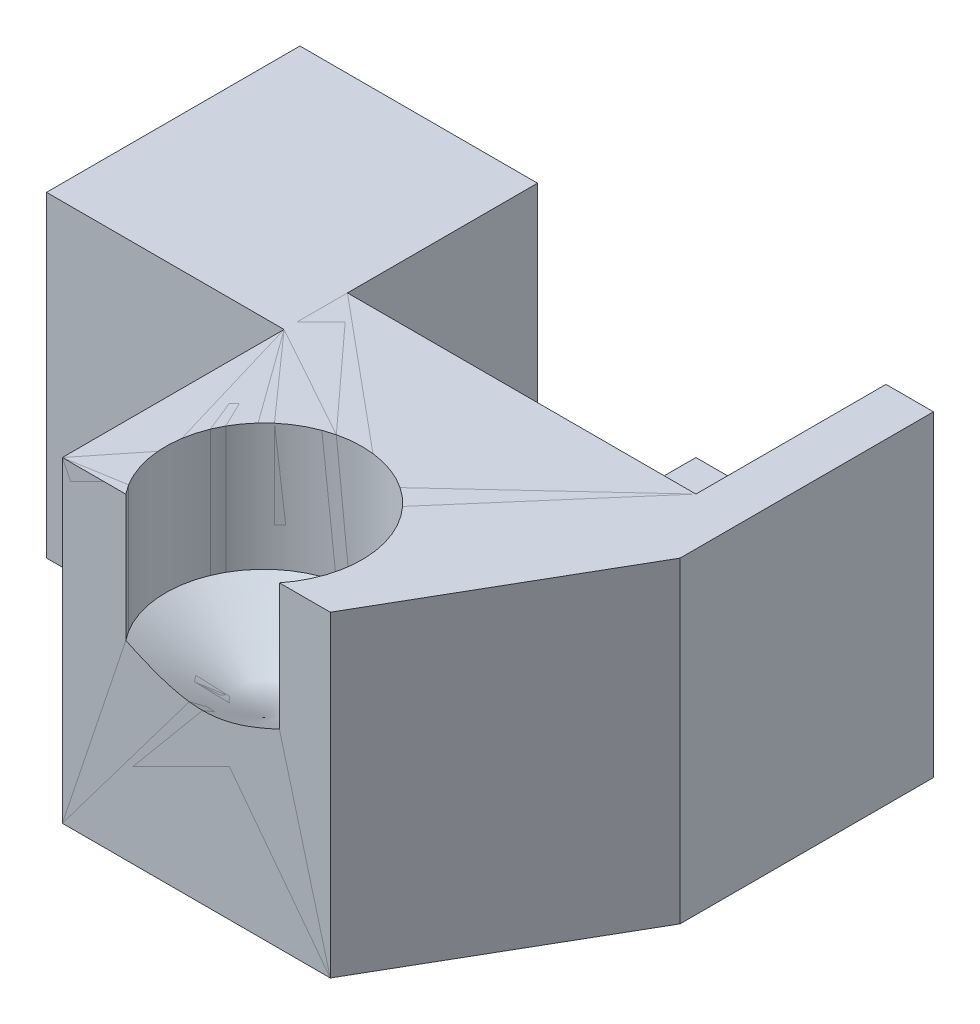
from build123d import *

# Parameters (mm, degrees)
BOSS_EXTRUDE1_DEPTH              = 100
TAP_DRILL_FOR_M68X6_0_TAP1_D     = 62
TAP_DRILL_FOR_M68X6_0_TAP1_DEPTH = 40
TAP_DRILL_FOR_M68X6_0_TAP1_TIP   = 18.62667919
SKETCH4_W                        = 60
SKETCH4_H                        = 60
CUT_EXTRUDE1_DEPTH               = 50
BODY_MOVE_COPY1_DEPTH            = 100
BODY_MOVE_COPY1_2_OUTLINE_W      = 60
BODY_MOVE_COPY1_2_OUTLINE_H      = 60
BODY_MOVE_COPY1_2_DEPTH          = 50
BODY_MOVE_COPY1_START            = 50
BODY_MOVE_COPY1_3_DEPTH          = 10


with BuildPart() as part:
    # Sketch1 → Boss-Extrude1 (new body)
    with BuildSketch(Plane(origin=(0, 0, 0), x_dir=(1, 0, 0), z_dir=(0, 1, 0))):
        Polygon((-135, 0), (-135, 80), (-60, 80), (-60, 20), (-10, 20), (-10, 80), (65, 80), (65, 0), (24.585481157, -70), (-60, -70), (-60, 0), align=None)
    extrude(amount=BOSS_EXTRUDE1_DEPTH)

    # Tap Drill for M68x6.0 Tap1
    with Locations(Plane(origin=(-15.729505574, 100, 50.672948166), x_dir=(0, 0, 1), z_dir=(0, 1, 0))):
        with Locations((0, 0)):
            Hole(TAP_DRILL_FOR_M68X6_0_TAP1_D / 2, depth=TAP_DRILL_FOR_M68X6_0_TAP1_DEPTH)
            with Locations((0, 0, -(TAP_DRILL_FOR_M68X6_0_TAP1_DEPTH + TAP_DRILL_FOR_M68X6_0_TAP1_TIP / 2))):  # 118° drill point
                Cone(0, TAP_DRILL_FOR_M68X6_0_TAP1_D / 2, TAP_DRILL_FOR_M68X6_0_TAP1_TIP, mode=Mode.SUBTRACT)

    # Sketch4 → Cut-Extrude1 (cut)
    with BuildSketch(Plane(origin=(0, 100, 0), x_dir=(1, 0, 0), z_dir=(0, 1, 0))):
        with Locations((20, 50)):
            Rectangle(SKETCH4_W, SKETCH4_H)
    extrude(amount=-CUT_EXTRUDE1_DEPTH, mode=Mode.SUBTRACT)


with BuildPart() as body_2:
    # Body-Move/Copy1: read off the stored shape, not the designer's step
    # Body-Move/Copy1 outline → Body-Move/Copy1 (new body)
    with BuildSketch(Plane(origin=(0, 0, 0), x_dir=(1, 0, 0), z_dir=(0, 1, 0))):
        with BuildLine():
            Line((50, 20), (-60, 20))
            Line((-60, 20), (-60, 80))
            Line((-60, 80), (-135, 80))
            Line((-135, 80), (-135, 0))
            Line((-135, 0), (-60, 0))
            Line((-60, 0), (-60, -70))
            Line((-60, -70), (-39.967184246, -70))
            ThreePointArc((-39.967184246, -70), (-15.729505575, -19.672948166), (8.508173097, -70))
            Line((8.508173097, -70), (24.585481157, -70))
            Line((24.585481157, -70), (65, 0))
            Line((65, 0), (65, 80))
            Line((65, 80), (50, 80))
            Line((50, 80), (50, 20))
        make_face()
    extrude(amount=BODY_MOVE_COPY1_DEPTH)

    # Body-Move_Copy1 2 outline → Body-Move_Copy1 2 (add)
    with BuildSketch(Plane(origin=(0, 0, 0), x_dir=(1, 0, 0), z_dir=(0, 1, 0))):
        with Locations((20, 50)):
            Rectangle(BODY_MOVE_COPY1_2_OUTLINE_W, BODY_MOVE_COPY1_2_OUTLINE_H)
        with BuildLine():
            Line((-39.967184246, -70), (8.508173097, -70))
            ThreePointArc((8.508173097, -70), (-15.729505575, -19.672948166), (-39.967184246, -70))
        make_face()
    extrude(amount=BODY_MOVE_COPY1_2_DEPTH)

    # Body-Move_Copy1 3 outline → Body-Move_Copy1 3 (add)
    with BuildSketch(Plane(origin=(0, 0, 0), x_dir=(1, 0, 0), z_dir=(0, 1, 0)).offset(BODY_MOVE_COPY1_START)):
        with BuildLine():
            Line((-39.967184246, -70), (8.508173097, -70))
            ThreePointArc((8.508173097, -70), (-15.729505575, -19.672948166), (-39.967184246, -70))
        make_face()
    extrude(amount=BODY_MOVE_COPY1_3_DEPTH)

    # Body-Move_Copy1 4 outline → Body-Move_Copy1 4 (revolve, cut)
    with BuildSketch(Plane(origin=(-15.729505574, 0, 50.672948166), x_dir=(1, 0, 0), z_dir=(0, 0, 1))):
        Polygon((0, 60.000000051), (0, 41.37332081), (31.000000085, 60.000000051), align=None)
    revolve(axis=Axis((-15.729505574, 0, 50.672948166), (0, 1, 0)), mode=Mode.SUBTRACT)


solid = Compound([part.part, body_2.part])
